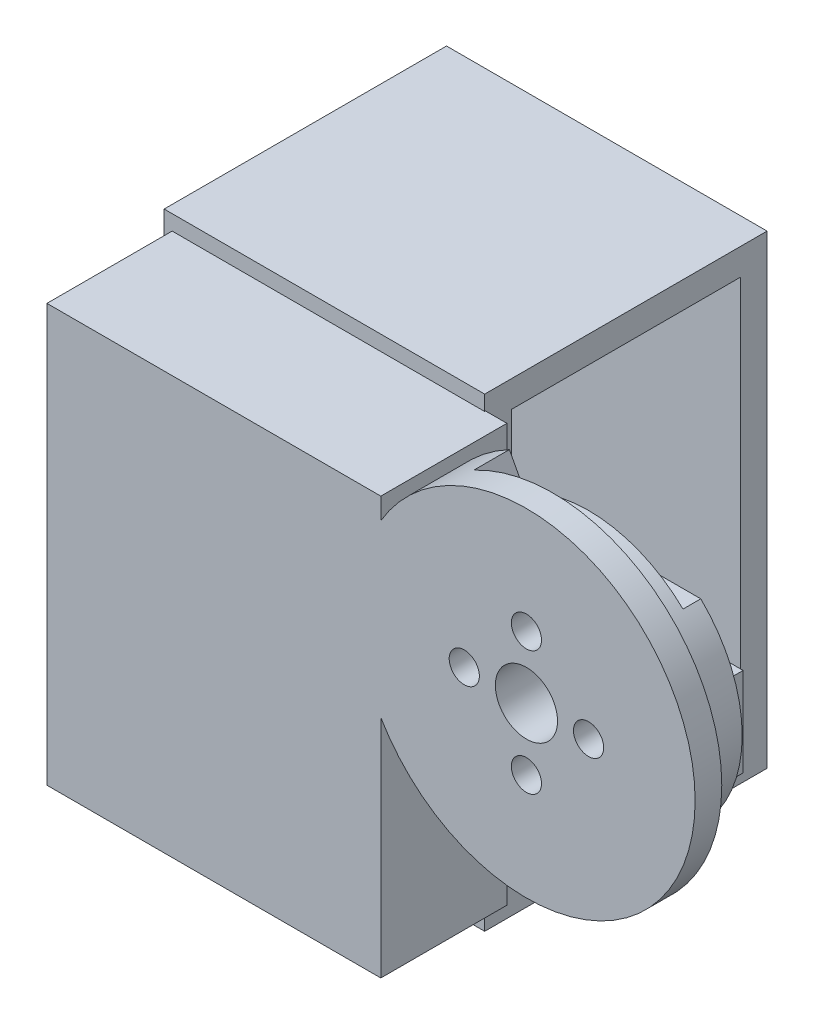
from build123d import *

# Parameters (mm, degrees)
S_CYL1_R        = 19
BOSS_1_DEPTH    = 7
BOSS_2_DEPTH    = 2.1
S_BOX3_W        = 28.2
S_BOX3_H        = 10
BOSS_3_DEPTH    = 1.5
S_BOX4_W        = 37.6
S_BOX4_H        = 47
BOSS_4_DEPTH    = 14.2
S_BOX5_W        = 36.1
S_BOX5_H        = 3
BOSS_5_DEPTH    = 31.8
S_BOX6_W        = 36.1
S_BOX6_H        = 3
BOSS_6_DEPTH    = 31.8
S_BOX7_W        = 36.1
S_BOX7_H        = 52.4
BOSS_7_DEPTH    = 3
S_BOX8_W        = 36.1
S_BOX8_H        = 52.4
BOSS_8_DEPTH    = 3
S_BOX9_W        = 4.6
S_BOX9_H        = 52.4
BOSS_9_DEPTH    = 31.8
S_HOLE10_R      = 10.5
HOLE_10_DEPTH   = 4.8
S_CUT11_W       = 4.75
S_CUT11_H       = 19.5
POCKET_11_DEPTH = 19.4
S_CUT12_W       = 4.75
S_CUT12_H       = 8.8
POCKET_12_DEPTH = 16.4
S_CUT13_W       = 4.75
S_CUT13_H       = 11
POCKET_13_DEPTH = 7
S_CUT14_W       = 2.9
S_CUT14_H       = 20
POCKET_14_DEPTH = 16.4
S_HOLE15_R      = 1.1
HOLE_15_DEPTH   = 4.8
S_HOLE16_R      = 2.3
HOLE_16_DEPTH   = 1.7
S_HOLE17_R      = 1.1
HOLE_17_DEPTH   = 4.8
S_HOLE18_R      = 2.3
HOLE_18_DEPTH   = 1.7
S_HOLE19_R      = 1.1
HOLE_19_DEPTH   = 4.8
S_HOLE20_R      = 2.3
HOLE_20_DEPTH   = 1.7
CUT_21_DEPTH    = 6.1
S_HOLE22_R      = 3.5
HOLE_22_DEPTH   = 10.6
S_HOLE23_R      = 1.7
HOLE_23_DEPTH   = 10.6
S_HOLE24_R      = 1.7
HOLE_24_DEPTH   = 10.6
S_HOLE25_R      = 1.7
HOLE_25_DEPTH   = 10.6
S_HOLE26_R      = 1.7
HOLE_26_DEPTH   = 10.6
S_HOLE27_R      = 3.2
HOLE_27_DEPTH   = 7.6
S_HOLE28_R      = 3.2
HOLE_28_DEPTH   = 7.6
S_HOLE29_R      = 3.2
HOLE_29_DEPTH   = 7.6
S_HOLE30_R      = 3.2
HOLE_30_DEPTH   = 7.6


with BuildPart() as part:
    # S_cyl1 → Boss_1 (new body)
    with BuildSketch(Plane.XY.offset(23)):
        Circle(S_CYL1_R)
    extrude(amount=BOSS_1_DEPTH)

    # S_prism2 → Boss_2 (add)
    with BuildSketch(Plane.XY.offset(21)):
        with BuildLine():
            Line((-15.491933385, -11), (15.491933385, -11))
            ThreePointArc((15.491933385, -11), (19, 0), (15.491933385, 11))
            Line((15.491933385, 11), (-15.491933385, 11))
            ThreePointArc((-15.491933385, 11), (-19, 0), (-15.491933385, -11))
        make_face()
    extrude(amount=BOSS_2_DEPTH)

    # S_box3 → Boss_3 (add)
    with BuildSketch(Plane.XY.offset(19.6)):
        with Locations((-0.1, 0)):
            Rectangle(S_BOX3_W, S_BOX3_H)
    extrude(amount=BOSS_3_DEPTH)

    # S_box4 → Boss_4 (add)
    with BuildSketch(Plane.XY.offset(15.8)):
        with Locations((-35.2, -11.5)):
            Rectangle(S_BOX4_W, S_BOX4_H)
    extrude(amount=BOSS_4_DEPTH)

    # S_box6 → Boss_6 (add)
    with BuildSketch(Plane.XY.offset(-15.9)):
        with Locations((-36.85, 12.2)):
            Rectangle(S_BOX6_W, S_BOX6_H)
    extrude(amount=BOSS_6_DEPTH)



with BuildPart() as body_2:
    # S_box5 → Boss_5 (new body)
    with BuildSketch(Plane.XY.offset(-15.9)):
        with Locations((-36.85, -37.2)):
            Rectangle(S_BOX5_W, S_BOX5_H)
    extrude(amount=BOSS_5_DEPTH)


with BuildPart() as part_1:
    add(part.part)

    add(body_2.part)  # Boss_7 merges body 2
    # S_box7 → Boss_7 (add)
    with BuildSketch(Plane.XY.offset(-15.9)):
        with Locations((-36.85, -12.5)):
            Rectangle(S_BOX7_W, S_BOX7_H)
    extrude(amount=BOSS_7_DEPTH)

    # S_box8 → Boss_8 (add)
    with BuildSketch(Plane.XY.offset(12.9)):
        with Locations((-36.85, -12.5)):
            Rectangle(S_BOX8_W, S_BOX8_H)
    extrude(amount=BOSS_8_DEPTH)

    # S_box9 → Boss_9 (add)
    with BuildSketch(Plane.XY.offset(-15.9)):
        with Locations((-52.6, -12.5)):
            Rectangle(S_BOX9_W, S_BOX9_H)
    extrude(amount=BOSS_9_DEPTH)

    # S_hole10 → Hole_10 (cut)
    with BuildSketch(Plane(origin=(-55, 0, 0), x_dir=(0, 0, -1), z_dir=(1, 0, 0))):
        Circle(S_HOLE10_R)
    extrude(amount=HOLE_10_DEPTH, mode=Mode.SUBTRACT)

    # S_cut11 → Pocket_11 (cut)
    with BuildSketch(Plane.XY.offset(-9.7)):
        with Locations((-52.625, -20.65)):
            Rectangle(S_CUT11_W, S_CUT11_H)
    extrude(amount=POCKET_11_DEPTH, mode=Mode.SUBTRACT)

    # S_cut12 → Pocket_12 (cut)
    with BuildSketch(Plane.XY.offset(-8.2)):
        with Locations((-52.625, -34.8)):
            Rectangle(S_CUT12_W, S_CUT12_H)
    extrude(amount=POCKET_12_DEPTH, mode=Mode.SUBTRACT)

    # S_cut13 → Pocket_13 (cut)
    with BuildSketch(Plane.XY.offset(-3.5)):
        with Locations((-52.625, -5.5)):
            Rectangle(S_CUT13_W, S_CUT13_H)
    extrude(amount=POCKET_13_DEPTH, mode=Mode.SUBTRACT)

    # S_cut14 → Pocket_14 (cut)
    with BuildSketch(Plane.XY.offset(-16.4)):
        with Locations((-53.65, 0)):
            Rectangle(S_CUT14_W, S_CUT14_H)
    extrude(amount=POCKET_14_DEPTH, mode=Mode.SUBTRACT)

    # S_hole15 → Hole_15 (cut)
    with BuildSketch(Plane(origin=(-55, 0, 0), x_dir=(0, 0, -1), z_dir=(1, 0, 0))):
        with Locations((-10.25, -8.3)):
            Circle(S_HOLE15_R)
    extrude(amount=HOLE_15_DEPTH, mode=Mode.SUBTRACT)

    # S_hole16 → Hole_16 (cut)
    with BuildSketch(Plane(origin=(-55, 0, 0), x_dir=(0, 0, -1), z_dir=(1, 0, 0))):
        with Locations((-10.25, -8.3)):
            Circle(S_HOLE16_R)
    extrude(amount=HOLE_16_DEPTH, mode=Mode.SUBTRACT)

    # S_hole17 → Hole_17 (cut)
    with BuildSketch(Plane(origin=(-55, 0, 0), x_dir=(0, 0, -1), z_dir=(1, 0, 0))):
        with Locations((10.25, -32.75)):
            Circle(S_HOLE17_R)
    extrude(amount=HOLE_17_DEPTH, mode=Mode.SUBTRACT)

    # S_hole18 → Hole_18 (cut)
    with BuildSketch(Plane(origin=(-55, 0, 0), x_dir=(0, 0, -1), z_dir=(1, 0, 0))):
        with Locations((10.25, -32.75)):
            Circle(S_HOLE18_R)
    extrude(amount=HOLE_18_DEPTH, mode=Mode.SUBTRACT)

    # S_hole19 → Hole_19 (cut)
    with BuildSketch(Plane(origin=(-55, 0, 0), x_dir=(0, 0, -1), z_dir=(1, 0, 0))):
        with Locations((-10.25, -32.75)):
            Circle(S_HOLE19_R)
    extrude(amount=HOLE_19_DEPTH, mode=Mode.SUBTRACT)

    # S_hole20 → Hole_20 (cut)
    with BuildSketch(Plane(origin=(-55, 0, 0), x_dir=(0, 0, -1), z_dir=(1, 0, 0))):
        with Locations((-10.25, -32.75)):
            Circle(S_HOLE20_R)
    extrude(amount=HOLE_20_DEPTH, mode=Mode.SUBTRACT)

    # S_pcut21 → Cut_21 (cut)
    with BuildSketch(Plane.XY.offset(20.9)):
        with BuildLine():
            Line((-9.201642631, 17.30577282), (-7.182914911, 13.509098171))
            ThreePointArc((-7.182914911, 13.509098171), (13.316442148, 7.53408047), (7.880082546, -13.114659701))
            Line((7.880082546, -13.114659701), (10.094746268, -16.800479094))
            ThreePointArc((10.094746268, -16.800479094), (17.05897164, 9.651501778), (-9.201642631, 17.30577282))
        make_face()
    extrude(amount=CUT_21_DEPTH, mode=Mode.SUBTRACT)

    # S_hole22 → Hole_22 (cut)
    with BuildSketch(Plane.XY.offset(19.5)):
        Circle(S_HOLE22_R)
    extrude(amount=HOLE_22_DEPTH, mode=Mode.SUBTRACT)

    # S_hole23 → Hole_23 (cut)
    with BuildSketch(Plane.XY.offset(19.5)):
        with Locations((7, 0)):
            Circle(S_HOLE23_R)
    extrude(amount=HOLE_23_DEPTH, mode=Mode.SUBTRACT)

    # S_hole24 → Hole_24 (cut)
    with BuildSketch(Plane.XY.offset(19.5)):
        with Locations((0, 7)):
            Circle(S_HOLE24_R)
    extrude(amount=HOLE_24_DEPTH, mode=Mode.SUBTRACT)

    # S_hole25 → Hole_25 (cut)
    with BuildSketch(Plane.XY.offset(19.5)):
        with Locations((-7, 0)):
            Circle(S_HOLE25_R)
    extrude(amount=HOLE_25_DEPTH, mode=Mode.SUBTRACT)

    # S_hole26 → Hole_26 (cut)
    with BuildSketch(Plane.XY.offset(19.5)):
        with Locations((0, -7)):
            Circle(S_HOLE26_R)
    extrude(amount=HOLE_26_DEPTH, mode=Mode.SUBTRACT)

    # S_hole27 → Hole_27 (cut)
    with BuildSketch(Plane.XY.offset(19.4)):
        with Locations((7, 0)):
            Circle(S_HOLE27_R)
    extrude(amount=HOLE_27_DEPTH, mode=Mode.SUBTRACT)

    # S_hole28 → Hole_28 (cut)
    with BuildSketch(Plane.XY.offset(19.4)):
        with Locations((0, 7)):
            Circle(S_HOLE28_R)
    extrude(amount=HOLE_28_DEPTH, mode=Mode.SUBTRACT)

    # S_hole29 → Hole_29 (cut)
    with BuildSketch(Plane.XY.offset(19.4)):
        with Locations((-7, 0)):
            Circle(S_HOLE29_R)
    extrude(amount=HOLE_29_DEPTH, mode=Mode.SUBTRACT)

    # S_hole30 → Hole_30 (cut)
    with BuildSketch(Plane.XY.offset(19.4)):
        with Locations((0, -7)):
            Circle(S_HOLE30_R)
    extrude(amount=HOLE_30_DEPTH, mode=Mode.SUBTRACT)


solid = part_1.part
